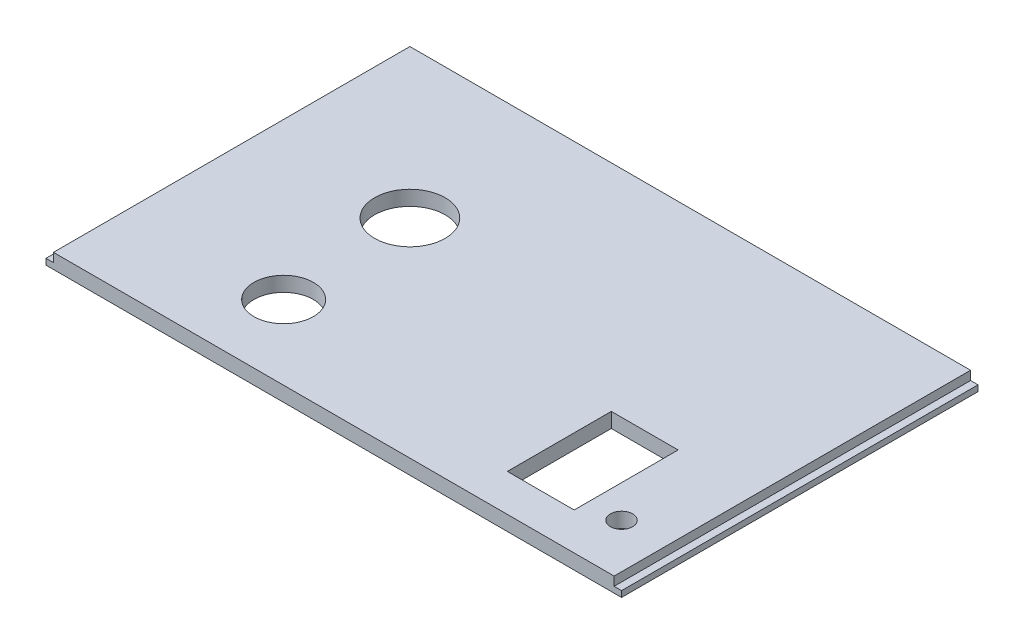
from build123d import *

# Parameters (mm, degrees)
SKETCH1_W              = 77.5
SKETCH1_H              = 48
BOSS_EXTRUDE1_DEPTH    = 2
SKETCH2_W              = 1
SKETCH2_H              = 48
CUT_EXTRUDE1_DEPTH     = 1.2
SKETCH3_R              = 4
CUT_EXTRUDE2_DEPTH     = 2
SKETCH4_R              = 1.5
SKETCH4_W              = 9
SKETCH4_H              = 14
CUT_EXTRUDE3_DEPTH     = 12
CUT_EXTRUDE4_OUTLINE_R = 4.75
CUT_EXTRUDE4_DEPTH     = 2


# Read off the part's stored shape, not the designer's step: Cut-Extrude4
with BuildPart() as part:
    # Sketch1 → Boss-Extrude1 (new body)
    with BuildSketch(Plane(origin=(0, 0, 0), x_dir=(1, 0, 0), z_dir=(0, 1, 0))):
        with Locations((38.75, 24)):
            Rectangle(SKETCH1_W, SKETCH1_H)
    extrude(amount=BOSS_EXTRUDE1_DEPTH)

    # Sketch2 → Cut-Extrude1 (cut)
    with BuildSketch(Plane(origin=(0, 2, 0), x_dir=(1, 0, 0), z_dir=(0, 1, 0))):
        with Locations((0.5, 24)):
            Rectangle(SKETCH2_W, SKETCH2_H)
        with Locations((77, 24)):
            Rectangle(SKETCH2_W, SKETCH2_H)
    extrude(amount=-CUT_EXTRUDE1_DEPTH, mode=Mode.SUBTRACT)

    # Sketch3 → Cut-Extrude2 (cut)
    with BuildSketch(Plane(origin=(0, 2, 0), x_dir=(1, 0, 0), z_dir=(0, 1, 0))):
        with Locations(Location((22, 10, 0), (0, 0, 270))):
            Circle(SKETCH3_R)
    extrude(amount=-CUT_EXTRUDE2_DEPTH, mode=Mode.SUBTRACT)

    # Sketch4 → Cut-Extrude3 (cut)
    with BuildSketch(Plane(origin=(0, 2, 0), x_dir=(1, 0, 0), z_dir=(0, 1, 0))):
        with Locations(Location((70.5, 7, 0), (0, 0, 270))):
            Circle(SKETCH4_R)
        with Locations((61.608422626, 12.013032017)):
            Rectangle(SKETCH4_W, SKETCH4_H)
    extrude(amount=-CUT_EXTRUDE3_DEPTH, mode=Mode.SUBTRACT)

    # Cut-Extrude4 outline → Cut-Extrude4 (cut)
    with BuildSketch(Plane(origin=(0, 0, 0), x_dir=(1, 0, 0), z_dir=(0, 1, 0))):
        with Locations((21, 28)):
            Circle(CUT_EXTRUDE4_OUTLINE_R)
    extrude(amount=CUT_EXTRUDE4_DEPTH, mode=Mode.SUBTRACT)


solid = part.part
